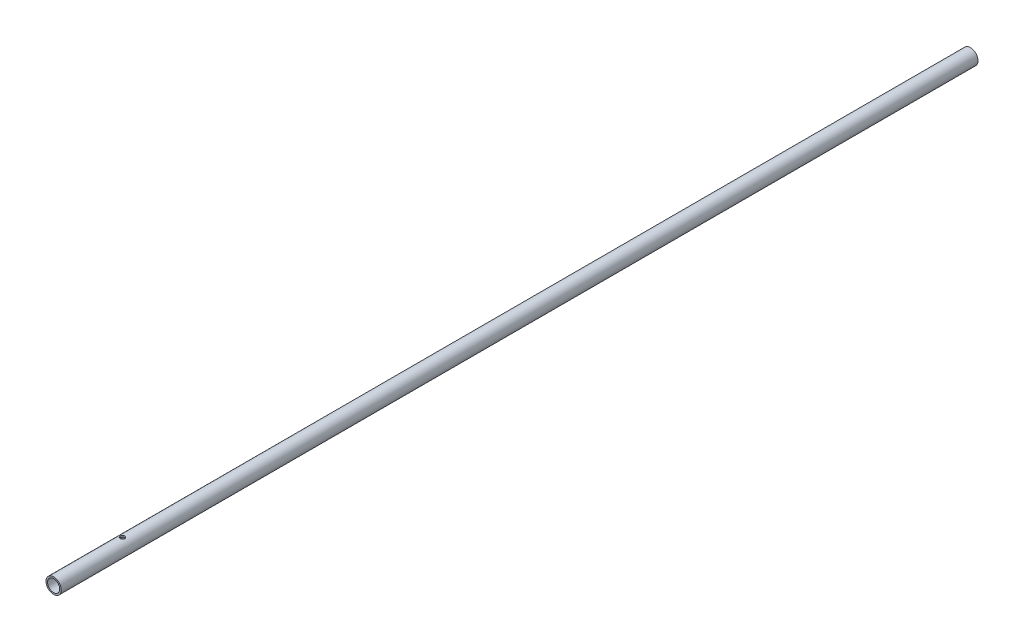
from build123d import *

# Parameters (mm, degrees)
SKETCH_1_R          = 5
SKETCH_1_R_2        = 4
EXTRUDE_1_DEPTH     = 600
SKETCH_2_R          = 1.5
CUT_EXTRUDE_1_DEPTH = 601.04166522
SKETCH_3_R          = 1.5
CUT_EXTRUDE_2_DEPTH = 601.041665322


with BuildPart() as part:
    # 草图1 → 凸台-拉伸1 (new body)
    with BuildSketch(Plane.XY):
        Circle(SKETCH_1_R)
        Circle(SKETCH_1_R_2, mode=Mode.SUBTRACT)
    extrude(amount=EXTRUDE_1_DEPTH)

    # 草图2 → 切除-拉伸1 (cut, through all)
    with BuildSketch(Plane(origin=(0, 0, 0), x_dir=(1, 0, 0), z_dir=(0, 1, 0))):
        with Locations((0, -31.334408431)):
            Circle(SKETCH_2_R)
    extrude(amount=-CUT_EXTRUDE_1_DEPTH, mode=Mode.SUBTRACT)

    # 草图3 → 切除-拉伸2 (cut, through all)
    with BuildSketch(Plane(origin=(0, 0, 0), x_dir=(1, 0, 0), z_dir=(0, 1, 0))):
        with Locations((0, -555)):
            Circle(SKETCH_3_R)
    extrude(amount=CUT_EXTRUDE_2_DEPTH, mode=Mode.SUBTRACT)


solid = part.part
